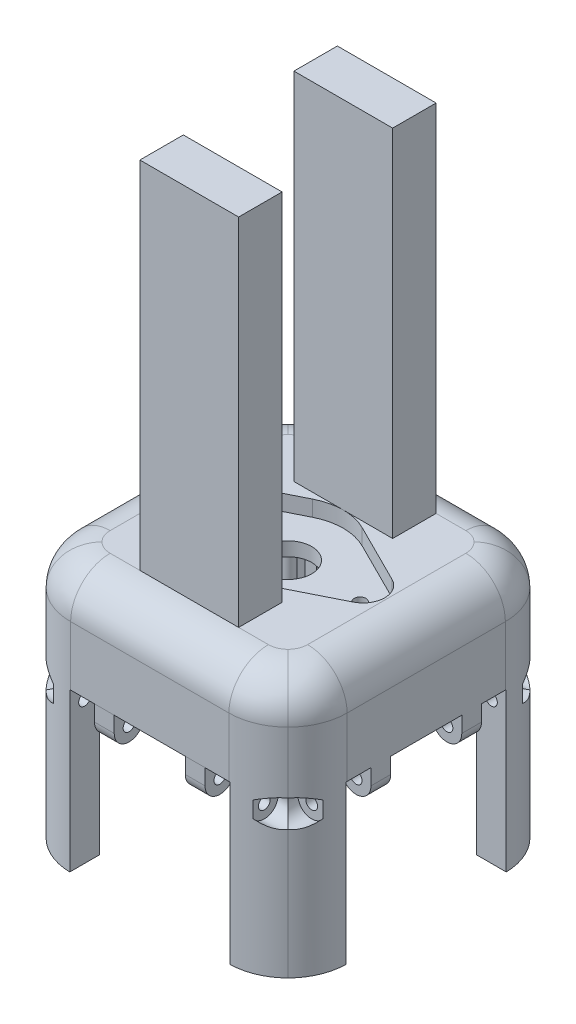
from build123d import *

# Parameters (mm, degrees)
MAIN_EXTRUDE_DEPTH                         = 65
SHELL2_T                                   = -7.5
SKETCH14_R                                 = 6
TOP_HOLE_DEPTH                             = 7.5
SKETCH24_W                                 = 40.5
SKETCH24_H                                 = 7.5
MAIN_DOOR_DEPTH                            = 40
DOOR_MIRROR_COUNT                          = 4
SKETCH35_R                                 = 1.5
DOOR_ROUNDING_DEPTH                        = 40.5
SKETCH35_3_R                               = 1.5
DOOR_SCREW_DEPTH                           = 93.209340633
SKETCH39_W                                 = 9
SKETCH39_H                                 = 7.5
SKETCH39_W_2                               = 6.25
DOOR_TEETH_DEPTH                           = 7.75
CIRPATTERN15_START                         = -32.7500001
CIRPATTERN15_OUTLINE_R                     = 1.5
CIRPATTERN15_DEPTH                         = 65.5000002
CIRPATTERN15_START_2                       = -14
CIRPATTERN15_2_OUTLINE_R                   = 1.5
CIRPATTERN15_2_DEPTH                       = 5
CIRPATTERN15_START_3                       = 9
CIRPATTERN15_3_OUTLINE_R                   = 1.5
CIRPATTERN15_3_DEPTH                       = 5
CIRPATTERN15_4_OUTLINE_R                   = 1.5
CIRPATTERN15_4_DEPTH                       = 5
CIRPATTERN15_5_OUTLINE_R                   = 1.5
CIRPATTERN15_5_DEPTH                       = 5
CIRPATTERN15_START_4                       = -32.75
CIRPATTERN15_6_OUTLINE_R                   = 1.5
CIRPATTERN15_6_DEPTH                       = 65.5
SIDE_FILLET_R                              = 15
SKETCH20_R                                 = 3.5
SKETCH20_R_2                               = 1.5
SCREW_SPACING_DEPTH                        = 20
SCREW_SPACING_WIDER_DOOR_COUNT             = 4
SCREW_SPACING_WIDER_DOOR_COPY_1_SKETCH_R   = 3.5
SCREW_SPACING_WIDER_DOOR_COPY_1_SKETCH_R_2 = 1.5
SCREW_SPACING_WIDER_DOOR_COPY_1_DEPTH      = 20
SCREW_SPACING_WIDER_DOOR_COPY_2_SKETCH_R   = 3.5
SCREW_SPACING_WIDER_DOOR_COPY_2_SKETCH_R_2 = 1.5
SCREW_SPACING_WIDER_DOOR_COPY_2_DEPTH      = 20
SCREW_SPACING_WIDER_DOOR_COPY_3_SKETCH_R   = 3.5
SCREW_SPACING_WIDER_DOOR_COPY_3_SKETCH_R_2 = 1.5
SCREW_SPACING_WIDER_DOOR_COPY_3_DEPTH      = 20
SKETCH40_R                                 = 1.6
BOLT_GUIDE_DEPTH                           = 50
SHELL_CORNER_FILLET_R                      = 5
SKETCH41_R                                 = 1.5
SCREW_HOLDER_PLACE_DEPTH                   = 4
SKETCH41_2_R                               = 1.5
SCREW_HOLDER_HOLES_DEPTH                   = 7.5
FILLET3_R                                  = 10
SKETCH43_W                                 = 25
SKETCH43_H                                 = 11
MOTOR_TOWERS_DEPTH                         = 90
SPRING_BACK_SUPPORT_DEPTH                  = 3
SPRING_BACK_SUPPORT_SUPPORT_SIZE           = 3
SPRING_CUT_OUTS_DEPTH                      = 6.5


with BuildPart() as part:
    # Sketch11 → main-extrude (new body)
    with BuildSketch(Plane(origin=(0, 0, 0), x_dir=(1, 0, 0), z_dir=(0, 1, 0))):
        Polygon((26.25, 35), (0, 35), (-26.25, 35), (-35, 26.25), (-35, 0), (-35, -26.25), (-26.25, -35), (0, -35), (26.25, -35), (35, -26.25), (35, 0), (35, 26.25), align=None)
    extrude(amount=MAIN_EXTRUDE_DEPTH)

    # Shell2
    shell2_openings = [part.faces().sort_by_distance(p)[0] for p in [
        (0, 0, 0),
    ]]
    offset(amount=SHELL2_T, openings=shell2_openings, kind=Kind.INTERSECTION)

    # Sketch14 → top-hole (cut)
    with BuildSketch(Plane(origin=(0, 65, 0), x_dir=(1, 0, 0), z_dir=(0, 1, 0))):
        with Locations(Location((0, 0, 0), (0, 0, 270))):
            Circle(SKETCH14_R)
    extrude(amount=-TOP_HOLE_DEPTH, mode=Mode.SUBTRACT)

    # Sketch24 → main-door (cut)
    with BuildSketch(Plane.XZ):
        with Locations((0, 31.25)):
            Rectangle(SKETCH24_W, SKETCH24_H)
    main_door = extrude(amount=-MAIN_DOOR_DEPTH, mode=Mode.SUBTRACT)

    # door-mirror: main-door ×4 about axis
    door_mirror_axis = Axis((0, 0, 0), (0, 1, 0))
    for i in range(1, DOOR_MIRROR_COUNT):
        add(main_door.rotate(door_mirror_axis, i * 360 / DOOR_MIRROR_COUNT), mode=Mode.SUBTRACT)

    # Sketch35<3> → door-screw (cut, symmetric)
    with BuildSketch(Plane.ZY.offset(-20.25)):
        with Locations((31.25, 36)):
            Circle(SKETCH35_3_R)
    extrude(amount=DOOR_SCREW_DEPTH, both=True, mode=Mode.SUBTRACT)

    # CirPattern15: read off the stored shape, not the designer's step
    # CirPattern15 outline → CirPattern15 (cut)
    with BuildSketch(Plane.XY.offset(CIRPATTERN15_START)):
        with Locations((31.25, 36)):
            Circle(CIRPATTERN15_OUTLINE_R)
        with Locations((-31.25, 36)):
            Circle(CIRPATTERN15_OUTLINE_R)
    extrude(amount=CIRPATTERN15_DEPTH, mode=Mode.SUBTRACT)

    # CirPattern15 2 outline → CirPattern15 2 (add)
    # profile 1 of 2: a face of its own
    with BuildSketch(Plane.XY.offset(CIRPATTERN15_START_2)):
        with BuildLine():
            ThreePointArc((27.5, 36), (31.25, 32.25), (35, 36))
            Line((35, 36), (35, 40))
            Line((35, 40), (27.5, 40))
            Line((27.5, 40), (27.5, 36))
        make_face()
        with Locations((31.25, 36)):
            Circle(CIRPATTERN15_2_OUTLINE_R, mode=Mode.SUBTRACT)
    # profile 2 of 2: a face of its own
    with BuildSketch(Plane.XY.offset(CIRPATTERN15_START_2)):
        with BuildLine():
            Line((-35, 40), (-35, 36))
            ThreePointArc((-35, 36), (-31.25, 32.25), (-27.5, 36))
            Line((-27.5, 36), (-27.5, 40))
            Line((-27.5, 40), (-35, 40))
        make_face()
        with Locations((-31.25, 36)):
            Circle(CIRPATTERN15_2_OUTLINE_R, mode=Mode.SUBTRACT)
    extrude(amount=CIRPATTERN15_2_DEPTH)

    # CirPattern15 3 outline → CirPattern15 3 (add)
    # profile 1 of 2: a face of its own
    with BuildSketch(Plane.XY.offset(CIRPATTERN15_START_3)):
        with BuildLine():
            ThreePointArc((27.5, 36), (31.25, 32.25), (35, 36))
            Line((35, 36), (35, 40))
            Line((35, 40), (27.5, 40))
            Line((27.5, 40), (27.5, 36))
        make_face()
        with Locations((31.25, 36)):
            Circle(CIRPATTERN15_3_OUTLINE_R, mode=Mode.SUBTRACT)
    # profile 2 of 2: a face of its own
    with BuildSketch(Plane.XY.offset(CIRPATTERN15_START_3)):
        with BuildLine():
            Line((-35, 40), (-35, 36))
            ThreePointArc((-35, 36), (-31.25, 32.25), (-27.5, 36))
            Line((-27.5, 36), (-27.5, 40))
            Line((-27.5, 40), (-35, 40))
        make_face()
        with Locations((-31.25, 36)):
            Circle(CIRPATTERN15_3_OUTLINE_R, mode=Mode.SUBTRACT)
    extrude(amount=CIRPATTERN15_3_DEPTH)

    # CirPattern15 4 outline → CirPattern15 4 (add)
    with BuildSketch(Plane.YZ.offset(CIRPATTERN15_START_2)):
        with BuildLine():
            ThreePointArc((36, -27.5), (32.25, -31.25), (36, -35))
            Line((36, -35), (40, -35))
            Line((40, -35), (40, -27.5))
            Line((40, -27.5), (36, -27.5))
        make_face()
        with Locations((36, -31.25)):
            Circle(CIRPATTERN15_4_OUTLINE_R, mode=Mode.SUBTRACT)
    extrude(amount=CIRPATTERN15_4_DEPTH)

    # CirPattern15 5 outline → CirPattern15 5 (add)
    with BuildSketch(Plane.YZ.offset(CIRPATTERN15_START_3)):
        with BuildLine():
            ThreePointArc((36, -27.5), (32.25, -31.25), (36, -35))
            Line((36, -35), (40, -35))
            Line((40, -35), (40, -27.5))
            Line((40, -27.5), (36, -27.5))
        make_face()
        with Locations((36, -31.25)):
            Circle(CIRPATTERN15_5_OUTLINE_R, mode=Mode.SUBTRACT)
    extrude(amount=CIRPATTERN15_5_DEPTH)

    # CirPattern15 6 outline → CirPattern15 6 (cut)
    with BuildSketch(Plane.YZ.offset(CIRPATTERN15_START_4)):
        with Locations((36, -31.25)):
            Circle(CIRPATTERN15_6_OUTLINE_R)
    extrude(amount=CIRPATTERN15_6_DEPTH, mode=Mode.SUBTRACT)

    # side-fillet
    # the kernel refuses this fillet: 15 mm, written as the material it takes off along each edge
    with BuildSketch(Plane(origin=(-35, -15.533008589, 26.25), x_dir=(0, 0, -1), z_dir=(0, 1, 0)), Plane(origin=(-35, -15.533008589, -26.25), x_dir=(0.7071067811868563, 0, -0.7071067811862388), z_dir=(0, 1, 0)), Plane(origin=(-26.25, -15.533008589, -35), x_dir=(1.0, 0, 1.851490460794824e-12), z_dir=(0, 1, 0)), Plane(origin=(-26.25, -15.533008589, 35), x_dir=(-0.7071067811863411, 0, -0.707106781186754), z_dir=(0, 1, 0))) as side_fillet_piece_1:
        with BuildLine():
            CenterArc((SIDE_FILLET_R * 0.414213562373, -SIDE_FILLET_R), SIDE_FILLET_R, 90, 45)
            Line((-SIDE_FILLET_R * 0.292893218814, -SIDE_FILLET_R * 0.292893218813), (0, 0))
            Line((0, 0), (SIDE_FILLET_R * 0.414213562373, 0))
        make_face()
    extrude(amount=96.066017178, mode=Mode.SUBTRACT)
    with BuildSketch(Plane(origin=(26.25, -15.533008589, -35), x_dir=(-1, 0, 0), z_dir=(0, 1, 0)), Plane(origin=(35, -15.533008589, -26.25), x_dir=(-0.7071067811865481, 0, -0.707106781186547), z_dir=(0, 1, 0)), Plane(origin=(35, -15.533008589, 26.25), x_dir=(0, 0, -1), z_dir=(0, 1, 0)), Plane(origin=(26.25, -15.533008589, 35), x_dir=(0.7071067811866493, 0, -0.7071067811864458), z_dir=(0, 1, 0))) as side_fillet_piece_2:
        with BuildLine():
            CenterArc((SIDE_FILLET_R * 0.414213562373, SIDE_FILLET_R), SIDE_FILLET_R, 225, 45)
            Line((-SIDE_FILLET_R * 0.292893218813, SIDE_FILLET_R * 0.292893218813), (0, 0))
            Line((0, 0), (SIDE_FILLET_R * 0.414213562373, 0))
        make_face()
    extrude(amount=96.066017178, mode=Mode.SUBTRACT)

    # Sketch20 → screw-spacing (cut)
    with BuildSketch(Plane.ZY.offset(-25.25)):
        with Locations((31.25, 36)):
            Circle(SKETCH20_R)
        with Locations(Location((31.25, 36, 0), (0, 0, 180))):
            Circle(SKETCH20_R_2, mode=Mode.SUBTRACT)
    screw_spacing = extrude(amount=-SCREW_SPACING_DEPTH, mode=Mode.SUBTRACT)

    # screw-spacing-mirror: screw-spacing across plane
    add(screw_spacing.mirror(Plane(origin=(0, 0, 0), x_dir=(0, 0, 1), z_dir=(1, 0, 0))), mode=Mode.SUBTRACT)

    # screw-spacing|wider-door: screw-spacing ×4 about axis
    screw_spacing_wider_door_axis = Axis((0, 0, 0), (0, 1, 0))
    for i in range(1, SCREW_SPACING_WIDER_DOOR_COUNT):
        add(screw_spacing.rotate(screw_spacing_wider_door_axis, i * 360 / SCREW_SPACING_WIDER_DOOR_COUNT), mode=Mode.SUBTRACT)

    # screw-spacing|wider-door copy 1 sketch → screw-spacing|wider-door copy 1 (cut)
    with BuildSketch(Plane(origin=(0, 0, 25.25), x_dir=(1, 0, 0), z_dir=(0, 0, -1))):
        with Locations((31.25, -36)):
            Circle(SCREW_SPACING_WIDER_DOOR_COPY_1_SKETCH_R)
        with Locations((31.25, -36)):
            Circle(SCREW_SPACING_WIDER_DOOR_COPY_1_SKETCH_R_2, mode=Mode.SUBTRACT)
    extrude(amount=-SCREW_SPACING_WIDER_DOOR_COPY_1_DEPTH, mode=Mode.SUBTRACT)

    # screw-spacing|wider-door copy 2 sketch → screw-spacing|wider-door copy 2 (cut)
    with BuildSketch(Plane(origin=(25.25, 0, 0), x_dir=(0, 0, -1), z_dir=(-1, 0, 0))):
        with Locations((31.25, -36)):
            Circle(SCREW_SPACING_WIDER_DOOR_COPY_2_SKETCH_R)
        with Locations((31.25, -36)):
            Circle(SCREW_SPACING_WIDER_DOOR_COPY_2_SKETCH_R_2, mode=Mode.SUBTRACT)
    extrude(amount=-SCREW_SPACING_WIDER_DOOR_COPY_2_DEPTH, mode=Mode.SUBTRACT)

    # screw-spacing|wider-door copy 3 sketch → screw-spacing|wider-door copy 3 (cut)
    with BuildSketch(Plane(origin=(0, 0, -25.25), x_dir=(-1, 0, 0), z_dir=(0, 0, 1))):
        with Locations((31.25, -36)):
            Circle(SCREW_SPACING_WIDER_DOOR_COPY_3_SKETCH_R)
        with Locations((31.25, -36)):
            Circle(SCREW_SPACING_WIDER_DOOR_COPY_3_SKETCH_R_2, mode=Mode.SUBTRACT)
    extrude(amount=-SCREW_SPACING_WIDER_DOOR_COPY_3_DEPTH, mode=Mode.SUBTRACT)

    # Sketch40 → bolt-guide (add)
    with BuildSketch(Plane.XZ.offset(-57.5)):
        with Locations(Location((-5.656854249, -5.656854249, 0), (0, 0, 90))):
            Circle(SKETCH40_R)
        with Locations(Location((5.656854249, 5.656854249, 0), (0, 0, 90))):
            Circle(SKETCH40_R)
    extrude(amount=BOLT_GUIDE_DEPTH)

    # shell-corner-fillet
    shell_corner_fillet_edges = [part.edges().sort_by_distance(p)[0] for p in [
        (0, 57.5, -27.5),
        (-25.321699141, 57.5, -25.321699141),
        (-27.5, 57.5, 0),
        (-25.321699141, 57.5, 25.321699141),
        (0, 57.5, 27.5),
        (25.321699141, 57.5, 25.321699141),
        (27.5, 57.5, 0),
        (25.321699141, 57.5, -25.321699141),
    ]]
    fillet(shell_corner_fillet_edges, radius=SHELL_CORNER_FILLET_R)

    # Sketch41 → screw-holder-place (cut)
    with BuildSketch(Plane(origin=(0, 65, 0), x_dir=(1, 0, 0), z_dir=(0, 1, 0))):
        with BuildLine():
            Line((-21.460526316, 4.918923688), (-6.263157895, 12.520896661))
            ThreePointArc((-6.263157895, 12.520896661), (0, 14), (6.263157895, 12.520896661))
            Line((6.263157895, 12.520896661), (21.460526316, 4.918923688))
            ThreePointArc((21.460526316, 4.918923688), (24.5, 0), (21.460526316, -4.918923688))
            Line((21.460526316, -4.918923688), (6.263157895, -12.520896661))
            ThreePointArc((6.263157895, -12.520896661), (0, -14), (-6.263157895, -12.520896661))
            Line((-6.263157895, -12.520896661), (-21.460526316, -4.918923688))
            ThreePointArc((-21.460526316, -4.918923688), (-24.5, 0), (-21.460526316, 4.918923688))
        make_face()
        with Locations(Location((-18.25, 0, 0), (0, 0, 270))):
            Circle(SKETCH41_R, mode=Mode.SUBTRACT)
        with Locations(Location((18.25, 0, 0), (0, 0, 90))):
            Circle(SKETCH41_R, mode=Mode.SUBTRACT)
    extrude(amount=-SCREW_HOLDER_PLACE_DEPTH, mode=Mode.SUBTRACT)

    # Sketch41<2> → screw-holder-holes (cut)
    with BuildSketch(Plane(origin=(0, 65, 0), x_dir=(1, 0, 0), z_dir=(0, 1, 0))):
        with Locations(Location((-18.25, 0, 0), (0, 0, 270))):
            Circle(SKETCH41_2_R)
        with Locations(Location((18.25, 0, 0), (0, 0, 270))):
            Circle(SKETCH41_2_R)
    extrude(amount=-SCREW_HOLDER_HOLES_DEPTH, mode=Mode.SUBTRACT)

    # Fillet3
    # the kernel refuses this fillet: 10 mm, written as the material it takes off along each edge
    with BuildSketch(Plane(origin=(-35, 65, 20.036796564), x_dir=(1, 0, 0), z_dir=(0, 0, -1)), Plane(origin=(20.036796564, 65, 35), x_dir=(0, 0, -1), z_dir=(-1, 0, 0)), Plane(origin=(35, 65, -20.036796564), x_dir=(-1, 0, 0), z_dir=(0, 0, 1))) as fillet3_piece_1:
        with BuildLine():
            CenterArc((FILLET3_R, FILLET3_R), FILLET3_R, 180, 90)
            Line((0, FILLET3_R), (0, 0))
            Line((0, 0), (FILLET3_R, 0))
        make_face()
    extrude(amount=40.073593129, mode=Mode.SUBTRACT)
    with BuildSketch(Plane(origin=(-20.036796564, 65, -35), x_dir=(0, -1, 0), z_dir=(1, 0, 0))) as fillet3_piece_2:
        with BuildLine():
            CenterArc((FILLET3_R, -FILLET3_R), FILLET3_R, 90, 90)
            Line((0, -FILLET3_R), (0, 0))
            Line((0, 0), (FILLET3_R, 0))
        make_face()
    extrude(amount=40.073593129, mode=Mode.SUBTRACT)
    with BuildSketch(Plane(origin=(-20.036796564, 65, 20), x_dir=(0, 0, 1), z_dir=(1, 0, 0))) as fillet3_piece_3:
        with BuildLine():
            CenterArc((15 - FILLET3_R, FILLET3_R), FILLET3_R, 270, 90)
            Line((15, FILLET3_R), (15, 0))
            Line((15, 0), (15 - FILLET3_R, 0))
        make_face()
    revolve(axis=Axis((-20.036796564, 65, 20), (0, -1, 0)), revolution_arc=44.900614311, mode=Mode.SUBTRACT)
    with BuildSketch(Plane(origin=(-20, 65, 20.036796564), x_dir=(-0.7083322695745986, 0, 0.7058791652112266), z_dir=(0.7058791652112266, 0, 0.7083322695745986))) as fillet3_piece_4:
        with BuildLine():
            CenterArc((15 - FILLET3_R, FILLET3_R), FILLET3_R, 270, 90)
            Line((15, FILLET3_R), (15, 0))
            Line((15, 0), (15 - FILLET3_R, 0))
        make_face()
    revolve(axis=Axis((-20, 65, 20.036796564), (0, -1, 0)), revolution_arc=44.900614305, mode=Mode.SUBTRACT)
    with BuildSketch(Plane(origin=(20.036796564, 65, 20), x_dir=(0.7058791652190647, 0, 0.7083322695667876), z_dir=(0.7083322695667876, 0, -0.7058791652190647))) as fillet3_piece_5:
        with BuildLine():
            CenterArc((15 - FILLET3_R, FILLET3_R), FILLET3_R, 270, 90)
            Line((15, FILLET3_R), (15, 0))
            Line((15, 0), (15 - FILLET3_R, 0))
        make_face()
    revolve(axis=Axis((20.036796564, 65, 20), (0, -1, 0)), revolution_arc=44.900614306, mode=Mode.SUBTRACT)
    with BuildSketch(Plane(origin=(20, 65, 20.036796564), x_dir=(1, 0, 0), z_dir=(0, 0, -1))) as fillet3_piece_6:
        with BuildLine():
            CenterArc((15 - FILLET3_R, FILLET3_R), FILLET3_R, 270, 90)
            Line((15, FILLET3_R), (15, 0))
            Line((15, 0), (15 - FILLET3_R, 0))
        make_face()
    revolve(axis=Axis((20, 65, 20.036796564), (0, -1, 0)), revolution_arc=44.90061431, mode=Mode.SUBTRACT)
    with BuildSketch(Plane(origin=(20, 65, -20.036796564), x_dir=(0.7083322695259066, 0, -0.7058791652600879), z_dir=(-0.7058791652600879, 0, -0.7083322695259066))) as fillet3_piece_7:
        with BuildLine():
            CenterArc((15 - FILLET3_R, FILLET3_R), FILLET3_R, 270, 90)
            Line((15, FILLET3_R), (15, 0))
            Line((15, 0), (15 - FILLET3_R, 0))
        make_face()
    revolve(axis=Axis((20, 65, -20.036796564), (0, -1, 0)), revolution_arc=44.900614309, mode=Mode.SUBTRACT)
    with BuildSketch(Plane(origin=(20.036796564, 65, -20), x_dir=(0, 0, -1), z_dir=(-1, 0, 0))) as fillet3_piece_8:
        with BuildLine():
            CenterArc((15 - FILLET3_R, FILLET3_R), FILLET3_R, 270, 90)
            Line((15, FILLET3_R), (15, 0))
            Line((15, 0), (15 - FILLET3_R, 0))
        make_face()
    revolve(axis=Axis((20.036796564, 65, -20), (0, -1, 0)), revolution_arc=44.900614307, mode=Mode.SUBTRACT)
    with BuildSketch(Plane(origin=(-20.036796564, 65, -20), x_dir=(-0.7058791652053447, 0, -0.7083322695804602), z_dir=(-0.7083322695804602, 0, 0.7058791652053447))) as fillet3_piece_9:
        with BuildLine():
            CenterArc((15 - FILLET3_R, FILLET3_R), FILLET3_R, 270, 90)
            Line((15, FILLET3_R), (15, 0))
            Line((15, 0), (15 - FILLET3_R, 0))
        make_face()
    revolve(axis=Axis((-20.036796564, 65, -20), (0, -1, 0)), revolution_arc=44.900614305, mode=Mode.SUBTRACT)
    with BuildSketch(Plane(origin=(-20, 65, -20.036796564), x_dir=(-1, 0, 0), z_dir=(0, 0, 1))) as fillet3_piece_10:
        with BuildLine():
            CenterArc((15 - FILLET3_R, FILLET3_R), FILLET3_R, 270, 90)
            Line((15, FILLET3_R), (15, 0))
            Line((15, 0), (15 - FILLET3_R, 0))
        make_face()
    revolve(axis=Axis((-20, 65, -20.036796564), (0, -1, 0)), revolution_arc=44.900614311, mode=Mode.SUBTRACT)

    # Sketch43 → motor-towers (add)
    with BuildSketch(Plane(origin=(0, 65, 0), x_dir=(1, 0, 0), z_dir=(0, 1, 0))):
        with Locations((0, 19.5)):
            Rectangle(SKETCH43_W, SKETCH43_H)
        with Locations((0, -19.5)):
            Rectangle(SKETCH43_W, SKETCH43_H)
    extrude(amount=MOTOR_TOWERS_DEPTH)

    # Sketch46 → spring-cut-outs (cut)
    with BuildSketch(Plane.ZY.offset(35)):
        Polygon((-9, 40), (-9, 36), (0, 36), (9, 36), (9, 40), (9, 47), (0, 47), (-9, 47), align=None)
    extrude(amount=-SPRING_CUT_OUTS_DEPTH, mode=Mode.SUBTRACT)


with BuildPart() as body_2:
    # Sketch35 → door-rounding (new body)
    with BuildSketch(Plane.ZY.offset(-20.25)):
        with BuildLine():
            Line((27.5, 40), (27.5, 36))
            ThreePointArc((27.5, 36), (31.25, 32.25), (35, 36))
            Line((35, 36), (35, 40))
            Line((35, 40), (27.5, 40))
        make_face()
        with Locations((31.25, 36)):
            Circle(SKETCH35_R, mode=Mode.SUBTRACT)
    extrude(amount=DOOR_ROUNDING_DEPTH)

    # Sketch39 → door-teeth (cut)
    with BuildSketch(Plane.XZ.offset(-32.25)):
        with Locations((4.5, 31.25)):
            Rectangle(SKETCH39_W, SKETCH39_H)
        with Locations((-4.5, 31.25)):
            Rectangle(SKETCH39_W, SKETCH39_H)
        with Locations((17.125, 31.25)):
            Rectangle(SKETCH39_W_2, SKETCH39_H)
        with Locations((-17.125, 31.25)):
            Rectangle(SKETCH39_W_2, SKETCH39_H)
    extrude(amount=-DOOR_TEETH_DEPTH, mode=Mode.SUBTRACT)


with BuildPart() as door_teeth_piece_1:
    # of the separate pieces the step leaves, piece 1, a body of its own (door_teeth_pieces)
    add(body_2.part.solids().sort_by_distance((14, 36, 27.5))[0])


with BuildPart() as door_teeth_piece_2:
    # of the separate pieces the step leaves, piece 2, a body of its own (door_teeth_pieces)
    add(body_2.part.solids().sort_by_distance((-9, 36, 27.5))[0])


with BuildPart() as body_4:
    # Sketch45 → spring-back-support (new body)
    with BuildSketch(Plane(origin=(-27.5, 0, 0), x_dir=(0, 0, -1), z_dir=(1, 0, 0))):
        Polygon((-12, 48), (-9, 48), (9, 48), (12, 48), (12, 40), (9, 40), (-9, 40), (-12, 40), align=None)
    extrude(amount=SPRING_BACK_SUPPORT_DEPTH)

    # spring-back-support-support
    spring_back_support_support_edges = [body_4.edges().sort_by_distance(p)[0] for p in [
        (-24.5, 44, 12),
        (-24.5, 48, 0),
        (-24.5, 44, -12),
    ]]
    chamfer(spring_back_support_support_edges, length=SPRING_BACK_SUPPORT_SUPPORT_SIZE - 0.0001)  # a hair under: the kernel refuses the full size


solid = Compound([part.part, door_teeth_piece_1.part, door_teeth_piece_2.part, body_4.part])
